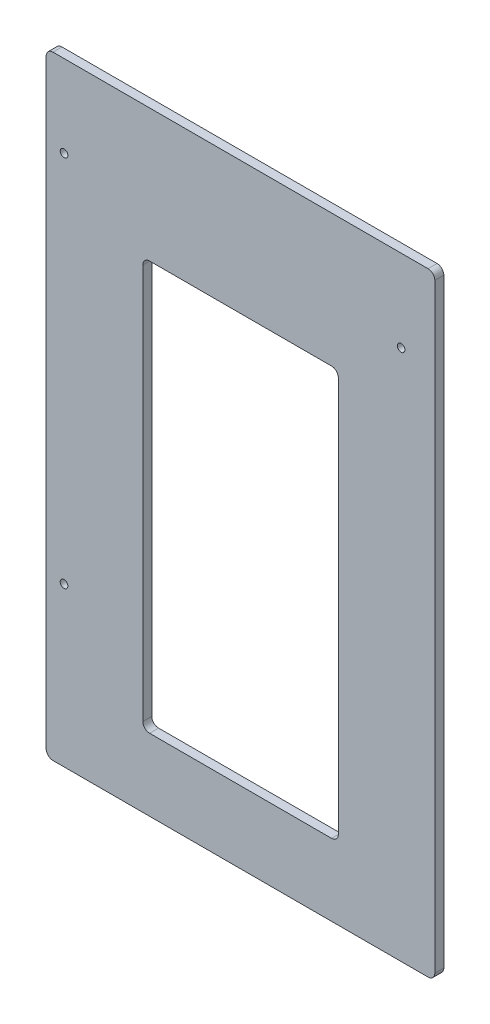
from build123d import *

# Parameters (mm, degrees)
ESQUISSE1_W        = 172.93
ESQUISSE1_H        = 273
ESQUISSE1_R        = 1.5
ESQUISSE1_W_2      = 87
ESQUISSE1_H_2      = 182
BOSS_EXTRU_1_DEPTH = 4
CONG_1_R           = 3
D_GAGEMENT_M31_D   = 3.4


with BuildPart() as part:
    # Esquisse1 → Boss.-Extru.1 (new body)
    with BuildSketch(Plane.XY):
        with Locations((86.465, 136.5)):
            Rectangle(ESQUISSE1_W, ESQUISSE1_H)
        with Locations((7.93, 236.5)):
            Circle(ESQUISSE1_R, mode=Mode.SUBTRACT)
        with Locations((7.93, 70.5)):
            Circle(ESQUISSE1_R, mode=Mode.SUBTRACT)
        with Locations((157.93, 236.5)):
            Circle(ESQUISSE1_R, mode=Mode.SUBTRACT)
        with Locations((86.5, 123)):
            Rectangle(ESQUISSE1_W_2, ESQUISSE1_H_2, mode=Mode.SUBTRACT)
    extrude(amount=BOSS_EXTRU_1_DEPTH)

    # Congé1
    cong_1_edges = [part.edges().sort_by_distance(p)[0] for p in [
        (0, 0, 2),
        (172.93, 0, 2),
        (172.93, 273, 2),
        (0, 273, 2),
        (43, 32, 2),
        (130, 32, 2),
        (130, 214, 2),
        (43, 214, 2),
    ]]
    fillet(cong_1_edges, radius=CONG_1_R)

    # Dégagement M31 (through all)
    with Locations(Plane.XY.offset(4)):
        with Locations((7.93, 236.5), (7.93, 70.5), (157.93, 236.5)):
            Hole(D_GAGEMENT_M31_D / 2)


solid = part.part
